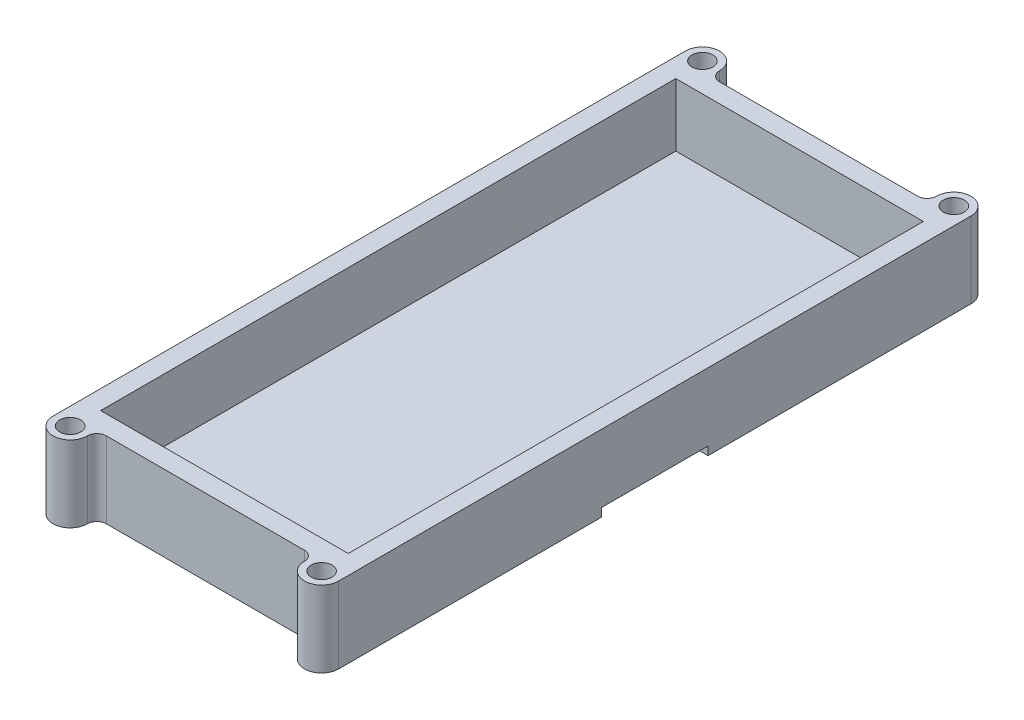
from build123d import *

# Parameters (mm, degrees)
SKETCH1_R           = 2.75
SKETCH1_W           = 65
SKETCH1_H           = 151
BOSS_EXTRUDE1_DEPTH = 20
SKETCH3_W           = 65
SKETCH3_H           = 151
BOSS_EXTRUDE2_DEPTH = 3.5
SKETCH4_W           = 27.94
SKETCH4_H           = 2.2
CUT_EXTRUDE1_DEPTH  = 117.966875653
FILLET1_R           = 2.5


with BuildPart() as part:
    # Sketch1 → Boss-Extrude1 (new body)
    with BuildSketch(Plane(origin=(0, 0, 0), x_dir=(1, 0, 0), z_dir=(0, 1, 0))):
        with BuildLine():
            Line((-37.5, 75.5), (-37.5, -75.5))
            Line((-37.5, -75.5), (-37.5, -83))
            ThreePointArc((-37.5, -83), (-33, -87.5), (-28.5, -83))
            Line((-28.5, -83), (-28.5, -80.5))
            Line((-28.5, -80.5), (28.5, -80.5))
            Line((28.5, -80.5), (28.5, -83))
            ThreePointArc((28.5, -83), (33, -87.5), (37.5, -83))
            Line((37.5, -83), (37.5, -75.5))
            Line((37.5, -75.5), (37.5, 75.5))
            Line((37.5, 75.5), (37.5, 83))
            ThreePointArc((37.5, 83), (33, 87.5), (28.5, 83))
            Line((28.5, 83), (28.5, 80.5))
            Line((28.5, 80.5), (-28.5, 80.5))
            Line((-28.5, 80.5), (-28.5, 83))
            ThreePointArc((-28.5, 83), (-33, 87.5), (-37.5, 83))
            Line((-37.5, 83), (-37.5, 75.5))
        make_face()
        with Locations(Location((-33, -83, 0), (0, 0, 270))):
            Circle(SKETCH1_R, mode=Mode.SUBTRACT)
        with Locations(Location((33, -83, 0), (0, 0, 90))):
            Circle(SKETCH1_R, mode=Mode.SUBTRACT)
        with Locations(Location((33, 83, 0), (0, 0, 270))):
            Circle(SKETCH1_R, mode=Mode.SUBTRACT)
        with Locations(Location((-33, 83, 0), (0, 0, 90))):
            Circle(SKETCH1_R, mode=Mode.SUBTRACT)
        Rectangle(SKETCH1_W, SKETCH1_H, mode=Mode.SUBTRACT)
    extrude(amount=BOSS_EXTRUDE1_DEPTH)

    # Sketch3 → Boss-Extrude2 (add)
    with BuildSketch(Plane.XZ):
        Rectangle(SKETCH3_W, SKETCH3_H)
    extrude(amount=-BOSS_EXTRUDE2_DEPTH)

    # Sketch4 → Cut-Extrude1 (cut, through all)
    with BuildSketch(Plane.ZY.offset(37.5)):
        with Locations((0, 1.1)):
            Rectangle(SKETCH4_W, SKETCH4_H)
    extrude(amount=-CUT_EXTRUDE1_DEPTH, mode=Mode.SUBTRACT)

    # Fillet1
    fillet1_edges = [part.edges().sort_by_distance(p)[0] for p in [
        (28.5, 10, 80.5),
        (-28.5, 10, 80.5),
        (28.5, 10, -80.5),
        (-28.5, 10, -80.5),
    ]]
    fillet(fillet1_edges, radius=FILLET1_R - 0.0001)  # a hair under: the kernel refuses the full size


solid = part.part
